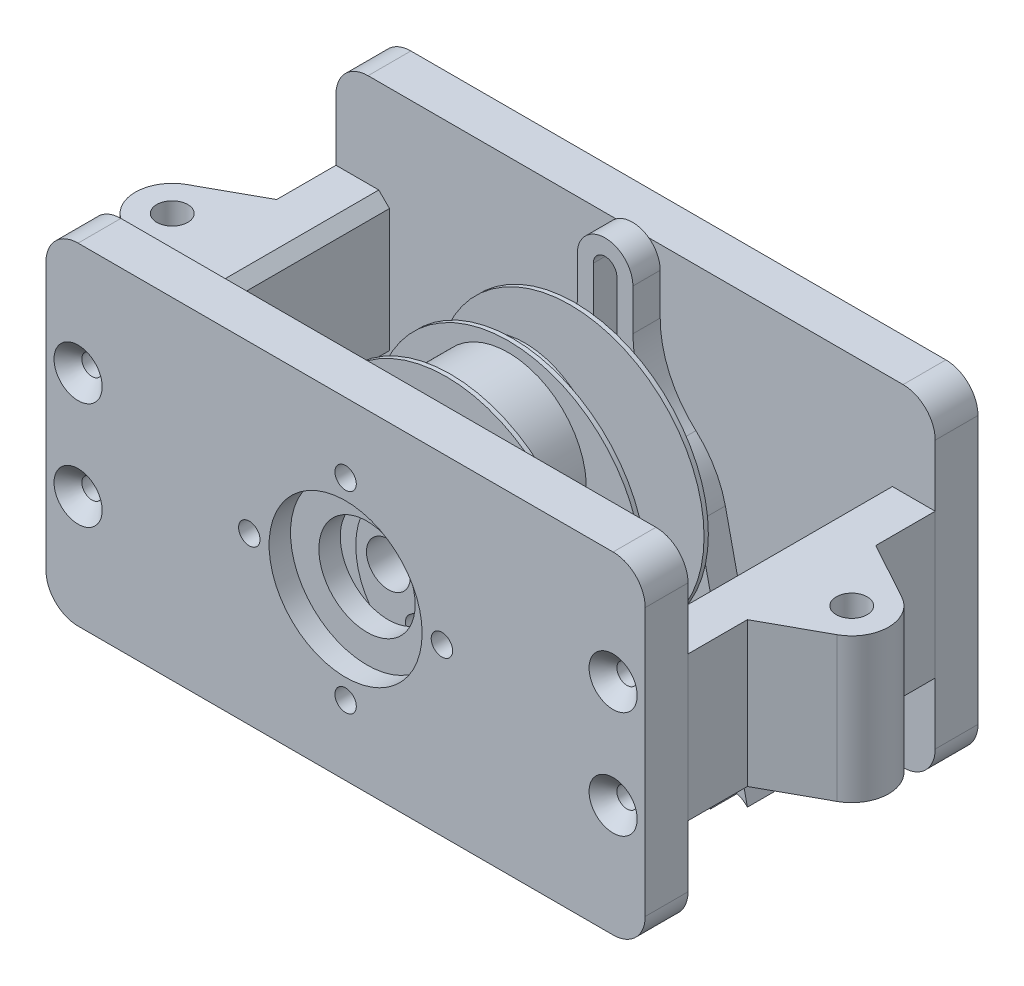
from build123d import *

# Parameters (mm, degrees)
SKETCH3_R                        = 7.4
BOSS_EXTRUDE1_DEPTH              = 2.55
SKETCH4_R                        = 2
CUT_EXTRUDE1_DEPTH               = 30.930654771
CIRPATTERN1_COUNT                = 4
CIRPATTERN1_ANGLE                = 23
CIRPATTERN1_THE_OTHER_WAY_COUNT  = 4
CIRPATTERN1_THE_OTHER_WAY_ANGLE  = 23
FILLET8_R                        = 10
CUT_EXTRUDE16_DEPTH              = 30.835470481
FILLET9_R                        = 3
BOSS_EXTRUDE5_START              = -0.3
SKETCH5_W                        = 56
SKETCH5_H                        = 31
SKETCH5_R                        = 1.2
SKETCH5_R_2                      = 0.95
BOSS_EXTRUDE5_DEPTH              = 4
BOSS_EXTRUDE6_START              = -4.3
SKETCH5_2_R                      = 1.2
BOSS_EXTRUDE6_DEPTH              = 4
SKETCH20_R                       = 1.2
CUT_EXTRUDE17_DEPTH              = 3.5
SKETCH6_R                        = 7.2
BOSS_EXTRUDE7_DEPTH              = 5.4
BOSS_EXTRUDE8_START              = 5.4
SKETCH6_4_R                      = 12.5
SKETCH6_4_R_2                    = 2.15
BOSS_EXTRUDE8_DEPTH              = 0.4
BOSS_EXTRUDE9_START              = 5.8
SKETCH6_5_R                      = 7.2
BOSS_EXTRUDE9_DEPTH              = 5.4
BOSS_EXTRUDE10_START             = 11.2
SKETCH6_6_R                      = 12.5
SKETCH6_6_R_2                    = 2.15
BOSS_EXTRUDE10_DEPTH             = 0.4
BOSS_EXTRUDE11_START             = 11.6
SKETCH6_7_R                      = 7.2
BOSS_EXTRUDE11_DEPTH             = 5.4
BOSS_EXTRUDE12_START             = 17
SKETCH6_8_R                      = 12.5
SKETCH6_8_R_2                    = 2.15
BOSS_EXTRUDE12_DEPTH             = 0.4
BOSS_EXTRUDE13_START             = 17.4
SKETCH6_9_R                      = 7.2
BOSS_EXTRUDE13_DEPTH             = 5.4
SKETCH7_W                        = 2.8875
SKETCH7_H                        = 13.5
BOSS_EXTRUDE14_DEPTH             = 5
BOSS_EXTRUDE15_REACH             = 49
SKETCH8_R                        = 1.45
BOSS_EXTRUDE15_DIRECTION_2_REACH = 49
SKETCH5_4_R                      = 0.95
CUT_EXTRUDE8_DEPTH               = 52.614070709
CHAMFER1_SIZE                    = 1
SKETCH10_3_R                     = 4.5
SKETCH10_3_R_2                   = 1
CUT_EXTRUDE5_DEPTH               = 4
CHAMFER3_SIZE                    = 1.3
SKETCH10_R                       = 7.15
SKETCH10_R_2                     = 4.5
CUT_EXTRUDE4_DEPTH               = 2
CUT_EXTRUDE6_START               = -31.1
SKETCH10_4_R                     = 4.5
CUT_EXTRUDE6_DEPTH               = 27.1
CHAMFER4_SIZE                    = 1.3
CHAMFER5_SIZE                    = 1.3
SKETCH11_R                       = 2.15
CUT_EXTRUDE7_DEPTH               = 3
FILLET2_R                        = 3
FILLET3_R                        = 3
CUT_EXTRUDE13_DEPTH              = 52.770477062
FILLET5_R                        = 1
CUT_EXTRUDE14_DEPTH              = 49.984306621
FILLET6_R                        = 1
CUT_EXTRUDE15_DEPTH              = 52.614070709
FILLET7_R                        = 1
MOVE_FACE1_BY                    = 0.1
MOVE_START                       = 17.4
MOVE_FACE2_OUTLINE_R             = 2.15
MOVE_FACE2_OUTLINE_R_2           = 2.05
MOVE_FACE2_DEPTH                 = 5.4
MOVE_FACE2_2_DEPTH               = 2.4
MOVE_FACE3_BY                    = 0.1
MOVE_FACE4_BY                    = 0.1
MOVE_FACE4_2_BY                  = 0.1
MOVE_FACE5_BY                    = 0.1
MOVE_FACE5_2_BY                  = 0.1
MOVE_FACE5_3_BY                  = 0.1
MOVE_FACE6_BY                    = 0.1
MOVE_FACE6_2_BY                  = 0.1
MOVE_FACE6_3_BY                  = 0.1


# Read off the part's stored shape, not the designer's step: Move Face2
with BuildPart() as part:
    # Sketch3 → Boss-Extrude1 (new body)
    with BuildSketch(Plane.XY):
        with BuildLine():
            ThreePointArc((2.6, 13.7), (0, 16.3), (-2.6, 13.7))
            Line((-2.6, 13.7), (-2.6, 4.261756575))
            ThreePointArc((-2.6, 4.261756575), (-6.534722105, 1.792135965), (-8.689034463, -2.323687436))
            Line((-8.689034463, -2.323687436), (-13.38353821, -23.499225407))
            ThreePointArc((-13.38353821, -23.499225407), (0, -26.65), (13.38353821, -23.499225407))
            Line((13.38353821, -23.499225407), (8.689034463, -2.323687436))
            ThreePointArc((8.689034463, -2.323687436), (6.534722105, 1.792135965), (2.6, 4.261756575))
            Line((2.6, 4.261756575), (2.6, 13.7))
        make_face()
        with BuildLine():
            Line((-1.1, 5.2), (-1.1, 13.7))
            ThreePointArc((-1.1, 13.7), (0, 14.8), (1.1, 13.7))
            Line((1.1, 13.7), (1.1, 5.2))
            ThreePointArc((1.1, 5.2), (0, 4.1), (-1.1, 5.2))
        make_face(mode=Mode.SUBTRACT)
        with Locations((0, -4.25)):
            Circle(SKETCH3_R, mode=Mode.SUBTRACT)
    extrude(amount=BOSS_EXTRUDE1_DEPTH)

    # Sketch4 → Cut-Extrude1 (cut, symmetric)
    with BuildSketch(Plane.XY):
        with Locations((0, -26.85)):
            Circle(SKETCH4_R)
    cut_extrude1 = extrude(amount=CUT_EXTRUDE1_DEPTH, both=True, mode=Mode.SUBTRACT)

    # CirPattern1: Cut-Extrude1 ×4 about axis
    cirpattern1_axis = Axis((0, 3.35, 0), (0, 0, 1))
    for i in range(1, CIRPATTERN1_COUNT):
        add(cut_extrude1.rotate(cirpattern1_axis, i * CIRPATTERN1_ANGLE / (CIRPATTERN1_COUNT - 1)), mode=Mode.SUBTRACT)

    # CirPattern1 the other way: Cut-Extrude1 ×4 about axis
    cirpattern1_the_other_way_axis = Axis((0, 3.35, 0), (0, 0, -1))
    for i in range(1, CIRPATTERN1_THE_OTHER_WAY_COUNT):
        add(cut_extrude1.rotate(cirpattern1_the_other_way_axis, i * CIRPATTERN1_THE_OTHER_WAY_ANGLE / (CIRPATTERN1_THE_OTHER_WAY_COUNT - 1)), mode=Mode.SUBTRACT)

    # Fillet8
    fillet8_edges = [part.edges().sort_by_distance(p)[0] for p in [
        (2.6, 4.261756575, 1.275),
        (-2.6, 4.261756575, 1.275),
    ]]
    fillet(fillet8_edges, radius=FILLET8_R)

    # Sketch19 → Cut-Extrude16 (cut, through all)
    with BuildSketch(Plane.XY.offset(2.55)):
        with BuildLine():
            Line((-10.545364644, -19.937504397), (-9.137601735, -13.587496275))
            ThreePointArc((-9.137601735, -13.587496275), (0, -12.65), (9.137601735, -13.587496275))
            Line((9.137601735, -13.587496275), (10.545364644, -19.937504397))
            ThreePointArc((10.545364644, -19.937504397), (0, -23.35), (-10.545364644, -19.937504397))
        make_face()
    extrude(amount=-CUT_EXTRUDE16_DEPTH, mode=Mode.SUBTRACT)

    # Fillet9
    fillet9_edges = [part.edges().sort_by_distance(p)[0] for p in [
        (10.545364644, -19.937504397, 1.275),
        (-10.545364644, -19.937504397, 1.275),
        (-9.137601735, -13.587496275, 1.275),
        (9.137601735, -13.587496275, 1.275),
    ]]
    fillet(fillet9_edges, radius=FILLET9_R)


with BuildPart() as body_2:
    # Sketch5 → Boss-Extrude5 (new body)
    with BuildSketch(Plane.XY.offset(BOSS_EXTRUDE5_START)):
        Rectangle(SKETCH5_W, SKETCH5_H)
        with Locations((-25, 10.45)):
            Circle(SKETCH5_R, mode=Mode.SUBTRACT)
        with Locations((25, 10.45)):
            Circle(SKETCH5_R, mode=Mode.SUBTRACT)
        with Locations(Location((25, -10.45, 0), (0, 0, 180))):
            Circle(SKETCH5_R, mode=Mode.SUBTRACT)
        with Locations(Location((-25, -10.45, 0), (0, 0, 180))):
            Circle(SKETCH5_R, mode=Mode.SUBTRACT)
        with Locations((-25, 5)):
            Circle(SKETCH5_R_2, mode=Mode.SUBTRACT)
        with Locations((-25, -5)):
            Circle(SKETCH5_R_2, mode=Mode.SUBTRACT)
        with Locations(Location((25, -5, 0), (0, 0, 180))):
            Circle(SKETCH5_R_2, mode=Mode.SUBTRACT)
        with Locations(Location((25, 5, 0), (0, 0, 180))):
            Circle(SKETCH5_R_2, mode=Mode.SUBTRACT)
    extrude(amount=-BOSS_EXTRUDE5_DEPTH)

    # Sketch5<2> → Boss-Extrude6 (add)
    with BuildSketch(Plane.XY.offset(BOSS_EXTRUDE6_START)):
        with Locations((-25, 10.45)):
            Circle(SKETCH5_2_R)
        with Locations((-25, -10.45)):
            Circle(SKETCH5_2_R)
        with Locations((25, 10.45)):
            Circle(SKETCH5_2_R)
        with Locations((25, -10.45)):
            Circle(SKETCH5_2_R)
    extrude(amount=BOSS_EXTRUDE6_DEPTH)

    # Sketch20 → Cut-Extrude17 (cut)
    with BuildSketch(Plane.XY.offset(-0.3)):
        with Locations((0, 13.7)):
            Circle(SKETCH20_R)
        with Locations(Location((0, -13.7, 0), (0, 0, 180))):
            Circle(SKETCH20_R)
    extrude(amount=-CUT_EXTRUDE17_DEPTH, mode=Mode.SUBTRACT)


with BuildPart() as body_3:
    # Sketch6 → Boss-Extrude7 (new body)
    with BuildSketch(Plane.XY):
        with Locations(Location((0, -4.25, 0), (0, 0, 180))):
            Circle(SKETCH6_R)
        with BuildLine():
            Line((-1.587450787, 1.45), (1.587450787, 1.45))
            ThreePointArc((1.587450787, 1.45), (0, -2.15), (-1.587450787, 1.45))
        make_face(mode=Mode.SUBTRACT)
    extrude(amount=BOSS_EXTRUDE7_DEPTH)

    # Sketch17 → Cut-Extrude15 (cut, through all)
    with BuildSketch(Plane(origin=(0, 0, 0), x_dir=(-1, 0, 0), z_dir=(0, 0, -1))):
        with BuildLine():
            ThreePointArc((-3.148037451, -0.111176471), (-2.309784108, -8.908851508), (5.2, -4.25))
            ThreePointArc((5.2, -4.25), (4.658851508, -1.940215892), (3.148037451, -0.111176471))
            ThreePointArc((3.148037451, -0.111176471), (0, -3.15), (-3.148037451, -0.111176471))
        make_face()
    extrude(amount=-CUT_EXTRUDE15_DEPTH, mode=Mode.SUBTRACT)

    # Fillet7
    fillet7_edges = [body_3.edges().sort_by_distance(p)[0] for p in [
        (3.148037451, -0.111176471, 2.7),
        (-3.148037451, -0.111176471, 2.7),
    ]]
    fillet(fillet7_edges, radius=FILLET7_R)

    # Move Face6: a face moved outward by 0.1
    extrude(body_3.faces().sort_by_distance((0, 1.45, 2.7))[0], amount=MOVE_FACE6_BY, dir=(0, -1, 0))

    # Move Face6 2: a curved face moved outward by 0.1
    add(Solid.thicken(body_3.faces().sort_by_distance((0, -2.15, 2.7))[0], MOVE_FACE6_2_BY))

    # Move Face6 3: a curved face moved outward by 0.1
    add(Solid.thicken(body_3.faces().sort_by_distance((7.2, -4.25, 2.7))[0], MOVE_FACE6_3_BY))


with BuildPart() as body_4:
    # Sketch6<4> → Boss-Extrude8 (new body)
    with BuildSketch(Plane.XY.offset(BOSS_EXTRUDE8_START)):
        Circle(SKETCH6_4_R)
        Circle(SKETCH6_4_R_2, mode=Mode.SUBTRACT)
    extrude(amount=BOSS_EXTRUDE8_DEPTH)


with BuildPart() as body_5:
    # Sketch6<5> → Boss-Extrude9 (new body)
    with BuildSketch(Plane.XY.offset(BOSS_EXTRUDE9_START)):
        with Locations(Location((-4.25, 0, 0), (0, 0, 180))):
            Circle(SKETCH6_5_R)
        with BuildLine():
            Line((-1.587450787, 1.45), (1.587450787, 1.45))
            ThreePointArc((1.587450787, 1.45), (0, -2.15), (-1.587450787, 1.45))
        make_face(mode=Mode.SUBTRACT)
    extrude(amount=BOSS_EXTRUDE9_DEPTH)

    # Move Face5: a face moved outward by 0.1
    extrude(body_5.faces().sort_by_distance((0, 1.45, 8.5))[0], amount=MOVE_FACE5_BY, dir=(0, -1, 0))

    # Move Face5 2: a curved face moved outward by 0.1
    add(Solid.thicken(body_5.faces().sort_by_distance((0, -2.15, 8.5))[0], MOVE_FACE5_2_BY))

    # Move Face5 3: a curved face moved outward by 0.1
    add(Solid.thicken(body_5.faces().sort_by_distance((2.95, 0, 8.5))[0], MOVE_FACE5_3_BY))


with BuildPart() as body_6:
    # Sketch6<6> → Boss-Extrude10 (new body)
    with BuildSketch(Plane.XY.offset(BOSS_EXTRUDE10_START)):
        Circle(SKETCH6_6_R)
        Circle(SKETCH6_6_R_2, mode=Mode.SUBTRACT)
    extrude(amount=BOSS_EXTRUDE10_DEPTH)


with BuildPart() as body_7:
    # Sketch6<7> → Boss-Extrude11 (new body)
    with BuildSketch(Plane.XY.offset(BOSS_EXTRUDE11_START)):
        with Locations(Location((0, 4.25, 0), (0, 0, 180))):
            Circle(SKETCH6_7_R)
        with BuildLine():
            Line((-1.587450787, 1.45), (1.587450787, 1.45))
            ThreePointArc((1.587450787, 1.45), (0, -2.15), (-1.587450787, 1.45))
        make_face(mode=Mode.SUBTRACT)
    extrude(amount=BOSS_EXTRUDE11_DEPTH)

    # Sketch16 → Cut-Extrude14 (cut, through all)
    with BuildSketch(Plane.XY.offset(17)):
        with BuildLine():
            ThreePointArc((3.614028032, 0.511176471), (4.787115299, 2.21935303), (5.2, 4.25))
            ThreePointArc((5.2, 4.25), (-2.03064697, 9.037115299), (-3.614028032, 0.511176471))
            ThreePointArc((-3.614028032, 0.511176471), (-3.30180916, 1.555813701), (-2.694974591, 2.461627907))
            ThreePointArc((-2.694974591, 2.461627907), (0, 3.65), (2.694974591, 2.461627907))
            ThreePointArc((2.694974591, 2.461627907), (3.30180916, 1.555813701), (3.614028032, 0.511176471))
        make_face()
    extrude(amount=-CUT_EXTRUDE14_DEPTH, mode=Mode.SUBTRACT)

    # Fillet6
    fillet6_edges = [body_7.edges().sort_by_distance(p)[0] for p in [
        (3.614028032, 0.511176471, 14.3),
        (-3.614028032, 0.511176471, 14.3),
    ]]
    fillet(fillet6_edges, radius=FILLET6_R)

    # Move Face3: a curved face moved outward by 0.1
    add(Solid.thicken(body_7.faces().sort_by_distance((7.2, 4.25, 14.3))[0], MOVE_FACE3_BY))

    # Move Face4: a face moved outward by 0.1
    extrude(body_7.faces().sort_by_distance((0, 1.45, 14.3))[0], amount=MOVE_FACE4_BY, dir=(0, -1, 0))

    # Move Face4 2: a curved face moved outward by 0.1
    add(Solid.thicken(body_7.faces().sort_by_distance((0, -2.15, 14.3))[0], MOVE_FACE4_2_BY))


with BuildPart() as body_8:
    # Sketch6<8> → Boss-Extrude12 (new body)
    with BuildSketch(Plane.XY.offset(BOSS_EXTRUDE12_START)):
        Circle(SKETCH6_8_R)
        Circle(SKETCH6_8_R_2, mode=Mode.SUBTRACT)
    extrude(amount=BOSS_EXTRUDE12_DEPTH)


with BuildPart() as body_9:
    # Sketch6<9> → Boss-Extrude13 (new body)
    with BuildSketch(Plane.XY.offset(BOSS_EXTRUDE13_START)):
        with Locations(Location((4.25, 0, 0), (0, 0, 180))):
            Circle(SKETCH6_9_R)
        with BuildLine():
            Line((-1.587450787, 1.45), (1.587450787, 1.45))
            ThreePointArc((1.587450787, 1.45), (0, -2.15), (-1.587450787, 1.45))
        make_face(mode=Mode.SUBTRACT)
    extrude(amount=BOSS_EXTRUDE13_DEPTH)

    # Sketch11 → Cut-Extrude7 (cut)
    with BuildSketch(Plane.XY.offset(22.8)):
        with Locations(Location((0, 0, 0), (0, 0, 137.590982222))):
            Circle(SKETCH11_R)
    extrude(amount=-CUT_EXTRUDE7_DEPTH, mode=Mode.SUBTRACT)

    # Sketch15 → Cut-Extrude13 (cut, through all)
    with BuildSketch(Plane.XY.offset(22.8)):
        with BuildLine():
            ThreePointArc((0.511176471, -3.614028032), (6.199117447, -4.820885933), (9.45, 0))
            ThreePointArc((9.45, 0), (6.199117447, 4.820885933), (0.511176471, 3.614028032))
            ThreePointArc((0.511176471, 3.614028032), (2.755748004, 2.393397782), (3.65, 0))
            ThreePointArc((3.65, 0), (2.755748004, -2.393397782), (0.511176471, -3.614028032))
        make_face()
    extrude(amount=-CUT_EXTRUDE13_DEPTH, mode=Mode.SUBTRACT)

    # Fillet5
    fillet5_edges = [body_9.edges().sort_by_distance(p)[0] for p in [
        (0.511176471, -3.614028032, 20.1),
        (0.511176471, 3.614028032, 20.1),
    ]]
    fillet(fillet5_edges, radius=FILLET5_R)

    # Move Face1: a curved face moved outward by 0.1
    add(Solid.thicken(body_9.faces().sort_by_distance((11.45, 0, 20.1))[0], MOVE_FACE1_BY))

    # Move Face2 outline → Move Face2 (add)
    with BuildSketch(Plane.XY.offset(MOVE_START)):
        Circle(MOVE_FACE2_OUTLINE_R)
        Circle(MOVE_FACE2_OUTLINE_R_2, mode=Mode.SUBTRACT)
    extrude(amount=MOVE_FACE2_DEPTH)

    # Move Face2 2 outline → Move Face2 2 (add)
    with BuildSketch(Plane.XY.offset(MOVE_START)):
        with BuildLine():
            ThreePointArc((-1.449137675, 1.45), (-1.496766635, 1.400781796), (-1.542724862, 1.35))
            Line((-1.542724862, 1.35), (1.542724862, 1.35))
            ThreePointArc((1.542724862, 1.35), (1.496766635, 1.400781796), (1.449137675, 1.45))
            Line((1.449137675, 1.45), (-1.449137675, 1.45))
        make_face()
    extrude(amount=MOVE_FACE2_2_DEPTH)


with BuildPart() as body_10:
    # Mirror1: mirrored copy
    add(body_2.part.mirror(Plane.XY.offset(11.25)))

    # Sketch10<3> → Cut-Extrude5 (cut)
    with BuildSketch(Plane.XY.offset(26.8)):
        Circle(SKETCH10_3_R)
        with Locations((-9, 0)):
            Circle(SKETCH10_3_R_2)
        with Locations((0, 9)):
            Circle(SKETCH10_3_R_2)
        with Locations((9, 0)):
            Circle(SKETCH10_3_R_2)
        with Locations((0, -9)):
            Circle(SKETCH10_3_R_2)
    extrude(amount=-CUT_EXTRUDE5_DEPTH, mode=Mode.SUBTRACT)

    # Chamfer3
    chamfer3_edges = [body_10.edges().sort_by_distance(p)[0] for p in [
        (-1, 9, 22.8),
        (8, 0, 22.8),
        (-1, -9, 22.8),
        (-10, 0, 22.8),
    ]]
    chamfer(chamfer3_edges, length=CHAMFER3_SIZE)

    # Sketch10 → Cut-Extrude4 (cut)
    with BuildSketch(Plane.XY.offset(26.8)):
        Circle(SKETCH10_R)
        Circle(SKETCH10_R_2, mode=Mode.SUBTRACT)
    extrude(amount=-CUT_EXTRUDE4_DEPTH, mode=Mode.SUBTRACT)

    # Chamfer5
    chamfer5_edges = [body_10.edges().sort_by_distance(p)[0] for p in [
        (-25.95, 5, 26.8),
        (-25.95, -5, 26.8),
        (25.95, -5, 26.8),
        (25.95, 5, 26.8),
    ]]
    chamfer(chamfer5_edges, length=CHAMFER5_SIZE)

    # Fillet2
    fillet2_edges = [body_10.edges().sort_by_distance(p)[0] for p in [
        (28, 15.5, 24.8),
        (28, -15.5, 24.8),
        (-28, -15.5, 24.8),
        (-28, 15.5, 24.8),
    ]]
    fillet(fillet2_edges, radius=FILLET2_R)


with BuildPart() as body_11:
    # Sketch7 → Boss-Extrude14 (new body)
    with BuildSketch(Plane(origin=(28, 0, 0), x_dir=(0, 0, -1), z_dir=(1, 0, 0))):
        with Locations((-1.14375, 0)):
            Rectangle(SKETCH7_W, SKETCH7_H)
        with Locations((-4.03125, 0)):
            Rectangle(SKETCH7_W, SKETCH7_H)
        with Locations((-6.91875, 0)):
            Rectangle(SKETCH7_W, SKETCH7_H)
        with Locations((-9.80625, 0)):
            Rectangle(SKETCH7_W, SKETCH7_H)
        with Locations((-12.69375, 0)):
            Rectangle(SKETCH7_W, SKETCH7_H)
        with Locations((-15.58125, 0)):
            Rectangle(SKETCH7_W, SKETCH7_H)
        with Locations((-18.46875, 0)):
            Rectangle(SKETCH7_W, SKETCH7_H)
        with Locations((-21.35625, 0)):
            Rectangle(SKETCH7_W, SKETCH7_H)
    extrude(amount=-BOSS_EXTRUDE14_DEPTH)

    # Boss-Extrude15: up to this face of the body (flat: up to its plane)
    boss_extrude15_end = Plane(body_11.part.faces().sort_by_distance((25.5, 6.75, 11.25))[0])
    # Sketch8 → Boss-Extrude15 (add, up to the picked face)
    with BuildSketch(Plane(origin=(0, 0, 0), x_dir=(1, 0, 0), z_dir=(0, 1, 0)), mode=Mode.PRIVATE) as boss_extrude15_sk1:
        with BuildLine():
            Line((33.412668691, -8.227082068), (28, -5.25))
            Line((28, -5.25), (28, -17.25))
            Line((28, -17.25), (33.412668691, -14.272917932))
            ThreePointArc((33.412668691, -14.272917932), (35.2, -11.25), (33.412668691, -8.227082068))
        make_face()
        with Locations(Location((31.75, -11.25, 0), (0, 0, 90))):
            Circle(SKETCH8_R, mode=Mode.SUBTRACT)
    boss_extrude15_tool1 = split(extrude(boss_extrude15_sk1.sketch, amount=BOSS_EXTRUDE15_REACH, mode=Mode.PRIVATE), bisect_by=boss_extrude15_end, keep=Keep.BOTH, mode=Mode.PRIVATE)
    add(boss_extrude15_tool1.solids().sort_by(Axis((35.060057, 0, 11.25), (0, 1, 0)))[0])

    # Boss-Extrude15 direction 2: up to this face of the body (flat: up to its plane)
    boss_extrude15_direction_2_end = Plane(body_11.part.faces().sort_by_distance((25.5, -6.75, 11.25))[0])
    # Sketch8 → Boss-Extrude15 direction 2 (add, up to the picked face)
    with BuildSketch(Plane(origin=(0, 0, 0), x_dir=(1, 0, 0), z_dir=(0, 1, 0)), mode=Mode.PRIVATE) as boss_extrude15_direction_2_sk1:
        with BuildLine():
            Line((33.412668691, -8.227082068), (28, -5.25))
            Line((28, -5.25), (28, -17.25))
            Line((28, -17.25), (33.412668691, -14.272917932))
            ThreePointArc((33.412668691, -14.272917932), (35.2, -11.25), (33.412668691, -8.227082068))
        make_face()
        with Locations(Location((31.75, -11.25, 0), (0, 0, 90))):
            Circle(SKETCH8_R, mode=Mode.SUBTRACT)
    boss_extrude15_direction_2_tool1 = split(extrude(boss_extrude15_direction_2_sk1.sketch, amount=-BOSS_EXTRUDE15_DIRECTION_2_REACH, mode=Mode.PRIVATE), bisect_by=boss_extrude15_direction_2_end, keep=Keep.BOTH, mode=Mode.PRIVATE)
    add(boss_extrude15_direction_2_tool1.solids().sort_by(Axis((35.060057, 0, 11.25), (0, -1, 0)))[0])

    # Sketch5<4> → Cut-Extrude8 (cut, through all)
    with BuildSketch(Plane.XY):
        with Locations(Location((25, -5, 0), (0, 0, 180))):
            Circle(SKETCH5_4_R)
        with Locations(Location((25, 5, 0), (0, 0, 180))):
            Circle(SKETCH5_4_R)
    extrude(amount=CUT_EXTRUDE8_DEPTH, mode=Mode.SUBTRACT)

    # Chamfer1
    chamfer1_edges = [body_11.edges().sort_by_distance(p)[0] for p in [
        (23, -6.75, 11.25),
        (23, 6.75, 11.25),
    ]]
    chamfer(chamfer1_edges, length=CHAMFER1_SIZE)


with BuildPart() as body_12:
    # Mirror2: mirrored copy
    add(body_11.part.mirror(Plane(origin=(0, 0, 0), x_dir=(0, 0, 1), z_dir=(1, 0, 0))))


with BuildPart() as body_2_1:
    add(body_2.part)

    # Sketch10<4> → Cut-Extrude6 (cut)
    with BuildSketch(Plane.XY.offset(26.8).offset(CUT_EXTRUDE6_START)):
        Circle(SKETCH10_4_R)
    extrude(amount=CUT_EXTRUDE6_DEPTH, mode=Mode.SUBTRACT)

    # Chamfer4
    chamfer4_edges = [body_2_1.edges().sort_by_distance(p)[0] for p in [
        (-25.95, 5, -4.3),
        (-25.95, -5, -4.3),
        (25.95, -5, -4.3),
        (25.95, 5, -4.3),
    ]]
    chamfer(chamfer4_edges, length=CHAMFER4_SIZE)

    # Fillet3
    fillet3_edges = [body_2_1.edges().sort_by_distance(p)[0] for p in [
        (28, 15.5, -2.3),
        (28, -15.5, -2.3),
        (-28, -15.5, -2.3),
        (-28, 15.5, -2.3),
    ]]
    fillet(fillet3_edges, radius=FILLET3_R)


solid = Compound([part.part, body_3.part, body_4.part, body_5.part, body_6.part, body_7.part, body_8.part, body_9.part, body_10.part, body_11.part, body_12.part, body_2_1.part])
